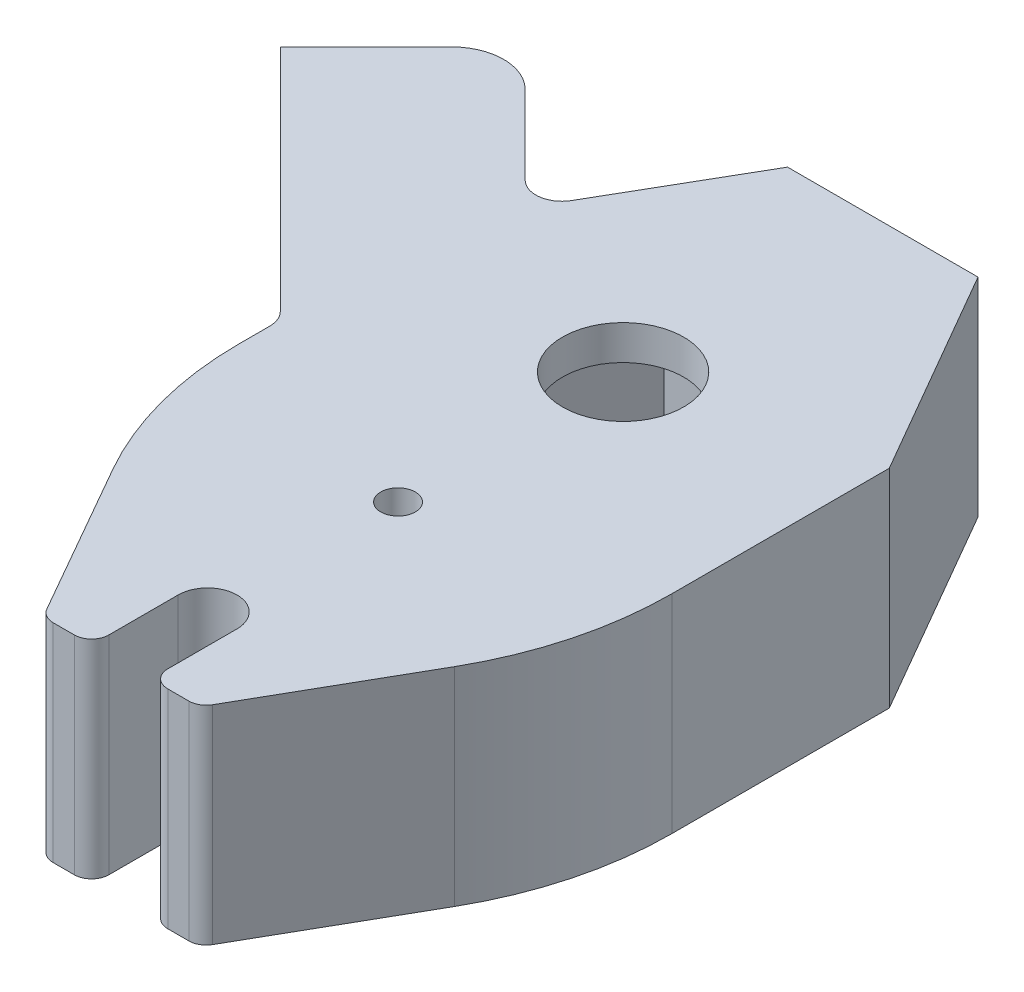
from build123d import *

# Parameters (mm, degrees)
SKETCH1_W           = 25
SKETCH1_H           = 30
BOSS_EXTRUDE1_DEPTH = 12
BOSS_EXTRUDE6_DEPTH = 12
CHAMFER1_SIZE       = 7
CHAMFER1_SIZE2      = 12.124355653
BOSS_EXTRUDE4_DEPTH = 12
SKETCH7_R           = 2.8
CUT_EXTRUDE2_DEPTH  = 12
CHAMFER2_SIZE       = 8
CHAMFER2_SIZE_2     = 14
CHAMFER3_SIZE       = 14
CHAMFER3_SIZE_2     = 8
FILLET2_R           = 20
FILLET3_R           = 1
FILLET4_R           = 1.5
SKETCH10_R          = 1
CUT_EXTRUDE3_DEPTH  = 41.859515416
SKETCH11_R          = 2
CUT_EXTRUDE4_DEPTH  = 41.859515416
SKETCH12_R          = 3.5
BOSS_EXTRUDE8_DEPTH = 2
FILLET5_R           = 3


with BuildPart() as part:
    # Sketch1 → Boss-Extrude1 (new body)
    with BuildSketch(Plane(origin=(0, 0, 0), x_dir=(1, 0, 0), z_dir=(0, 1, 0))):
        Rectangle(SKETCH1_W, SKETCH1_H)
        Polygon((3.233161507, -5.6), (6.466323015, 0), (3.233161507, 5.6), (-3.233161507, 5.6), (-6.466323015, 0), (-3.233161507, -5.6), align=None, mode=Mode.SUBTRACT)
    extrude(amount=BOSS_EXTRUDE1_DEPTH)

    # Sketch8 → Boss-Extrude6 (add)
    with BuildSketch(Plane(origin=(0, 0, 0), x_dir=(1, 0, 0), z_dir=(0, 1, 0))):
        with BuildLine():
            Line((-4.5, -15), (4.5, -15))
            Line((4.5, -15), (4.5, -29))
            Line((4.5, -29), (1.7, -29))
            Line((1.7, -29), (1.7, -24))
            ThreePointArc((1.7, -24), (0, -22.3), (-1.7, -24))
            Line((-1.7, -24), (-1.7, -29))
            Line((-1.7, -29), (-4.5, -29))
            Line((-4.5, -29), (-4.5, -15))
        make_face()
    extrude(amount=BOSS_EXTRUDE6_DEPTH)

    # Chamfer1
    chamfer1_edges = [part.edges().sort_by_distance(p)[0] for p in [
        (-12.5, 6, -15),
        (12.5, 6, -15),
    ]]
    chamfer1_side = [part.faces().sort_by_distance(p)[0] for p in [
        (0, 6, -15),
    ]]
    chamfer(chamfer1_edges, length=CHAMFER1_SIZE, length2=CHAMFER1_SIZE2, reference=chamfer1_side[0])

    # Sketch6 → Boss-Extrude4 (add)
    with BuildSketch(Plane(origin=(0, 0, 0), x_dir=(1, 0, 0), z_dir=(0, 1, 0))):
        Polygon((-26.162950904, 6.363961031), (-12.5, -7.298989873), (-12.5, 2.875644347), (-11.047793697, 5.390939447), (-19.091883092, 13.435028843), align=None)
    extrude(amount=BOSS_EXTRUDE4_DEPTH)

    # Sketch7 → Cut-Extrude2 (cut)
    with BuildSketch(Plane(origin=(-9.899494937, 0, 9.899494937), x_dir=(0.7071067811865438, 0, 0.7071067811865512), z_dir=(-0.7071067811865512, 0, 0.7071067811865438))):
        with Locations((-18, 6)):
            Circle(SKETCH7_R)
    extrude(amount=-CUT_EXTRUDE2_DEPTH, mode=Mode.SUBTRACT)

    # Chamfer2
    # the kernel refuses this chamfer: 14, 8 mm, written as the material it adds along each edge
    with BuildSketch(Plane(origin=(4.5, 0, 15), x_dir=(0.9982794274996464, 0, -0.05863603525971087), z_dir=(0, 1, 0))) as chamfer2_piece_1:
        Polygon((CHAMFER2_SIZE * 0.9982794275, -CHAMFER2_SIZE * 0.0586360352597), (-CHAMFER2_SIZE_2 * 0.0586360352597, -CHAMFER2_SIZE_2 * 0.9982794275), (0, 0), align=None)
    extrude(amount=12)

    # Chamfer3
    # the kernel refuses this chamfer: 14, 8 mm, written as the material it adds along each edge
    with BuildSketch(Plane(origin=(-4.5, 0, 15), x_dir=(0.019175933519162247, 0, 0.9998161248818048), z_dir=(0, 1, 0))) as chamfer3_piece_1:
        Polygon((CHAMFER3_SIZE * 0.999816124882, -CHAMFER3_SIZE * 0.0191759335192), (-CHAMFER3_SIZE_2 * 0.0191759335192, -CHAMFER3_SIZE_2 * 0.999816124882), (0, 0), align=None)
    extrude(amount=12)

    # Fillet2
    fillet2_edges = [part.edges().sort_by_distance(p)[0] for p in [
        (12.5, 6, 15),
        (-12.5, 6, 15),
    ]]
    fillet(fillet2_edges, radius=FILLET2_R)

    # Fillet3
    fillet3_edges = [part.edges().sort_by_distance(p)[0] for p in [
        (-4.5, 6, 29),
        (-1.7, 6, 29),
        (1.7, 6, 29),
        (4.5, 6, 29),
    ]]
    fillet(fillet3_edges, radius=FILLET3_R)

    # Fillet4
    fillet4_edges = [part.edges().sort_by_distance(p)[0] for p in [
        (-12.5, 6, 7.298989873),
        (-11.047793697, 6, -5.390939447),
    ]]
    fillet(fillet4_edges, radius=FILLET4_R)

    # Sketch10 → Cut-Extrude3 (cut, through all)
    with BuildSketch(Plane(origin=(0, 12, 0), x_dir=(1, 0, 0), z_dir=(0, 1, 0))):
        with Locations(Location((0, -13, 0), (0, 0, 270))):
            Circle(SKETCH10_R)
    extrude(amount=-CUT_EXTRUDE3_DEPTH, mode=Mode.SUBTRACT)

    # Sketch11 → Cut-Extrude4 (cut, through all)
    with BuildSketch(Plane(origin=(0, 0, 0), x_dir=(0, 0, -1), z_dir=(1, 0, 0))):
        with Locations((-13, 6)):
            Circle(SKETCH11_R)
    extrude(amount=-CUT_EXTRUDE4_DEPTH, mode=Mode.SUBTRACT)

    # Sketch12 → Boss-Extrude8 (add)
    with BuildSketch(Plane(origin=(0, 12, 0), x_dir=(1, 0, 0), z_dir=(0, 1, 0))):
        Polygon((3.233161507, 5.6), (-3.233161507, 5.6), (-6.466323015, 0), (-3.233161507, -5.6), (3.233161507, -5.6), (6.466323015, 0), align=None)
        with Locations(Location((0, 0, 0), (0, 0, 270))):
            Circle(SKETCH12_R, mode=Mode.SUBTRACT)
    extrude(amount=-BOSS_EXTRUDE8_DEPTH)

    # Fillet5
    # the kernel refuses this fillet: 3 mm, written as the material it takes off along each edge
    with BuildSketch(Plane(origin=(-19.091883092, -7.5, -13.435028843), x_dir=(-0.7071067811865517, 0, 0.7071067811865434), z_dir=(0, 1, 0))) as fillet5_piece_1:
        with BuildLine():
            CenterArc((FILLET5_R, FILLET5_R), FILLET5_R, 180, 90)
            Line((0, FILLET5_R), (0, 0))
            Line((0, 0), (FILLET5_R, 0))
        make_face()
    extrude(amount=27, mode=Mode.SUBTRACT)


solid = part.part
